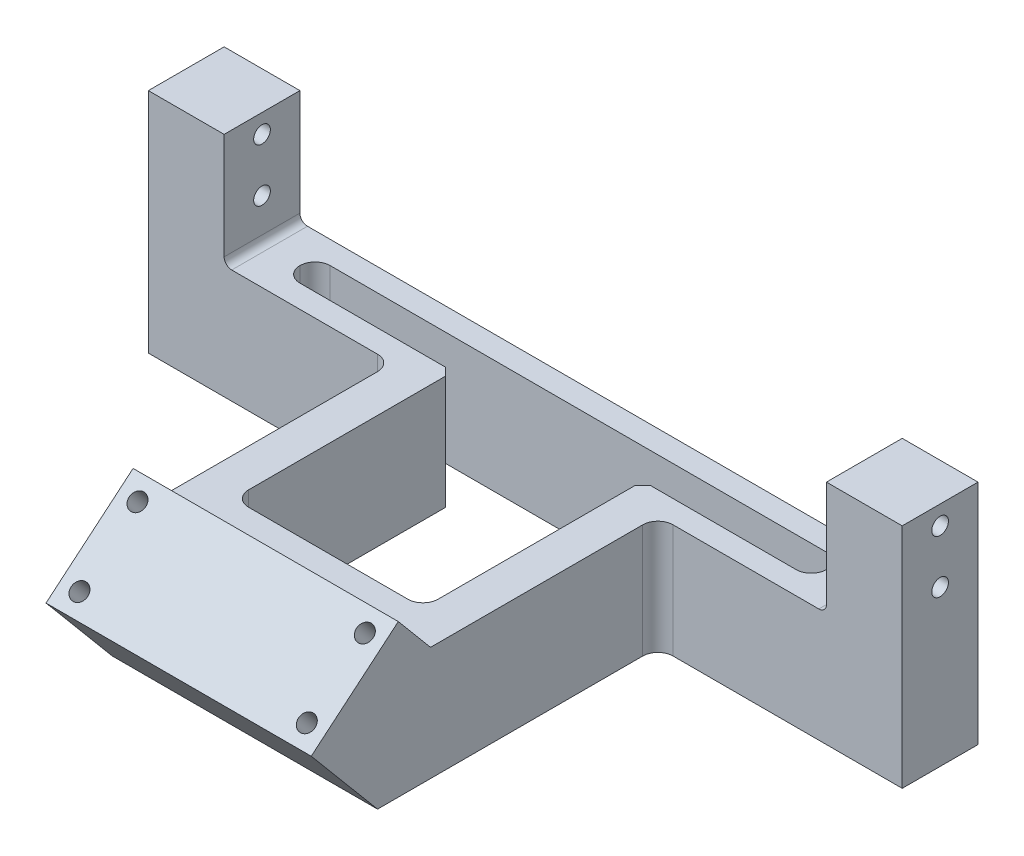
from build123d import *

# Parameters (mm, degrees)
BOSS_EXTRUDE1_DEPTH = 12.7
SKETCH2_R           = 1.397
CUT_EXTRUDE1_DEPTH  = 133.569206561
FILLET1_R           = 1.27
BOSS_EXTRUDE2_DEPTH = 22.225
CUT_EXTRUDE3_DEPTH  = 97.775414884
FILLET3_R           = 2.54
CHAMFER1_SIZE       = 1.27
SKETCH7_R           = 1.397
CUT_EXTRUDE4_DEPTH  = 6.35


with BuildPart() as part:
    # Sketch1 → Boss-Extrude1 (new body)
    with BuildSketch(Plane.XY):
        Polygon((63.1698, 0), (-63.1698, 0), (-63.1698, 38.1), (-50.4698, 38.1), (-50.4698, 19.05), (50.4698, 19.05), (50.4698, 38.1), (63.1698, 38.1), align=None)
    extrude(amount=BOSS_EXTRUDE1_DEPTH)

    # Sketch2 → Cut-Extrude1 (cut, through all)
    with BuildSketch(Plane.ZY.offset(63.1698)):
        with Locations((6.35, 34.925)):
            Circle(SKETCH2_R)
        with Locations((6.35, 26.035)):
            Circle(SKETCH2_R)
    extrude(amount=-CUT_EXTRUDE1_DEPTH, mode=Mode.SUBTRACT)

    # Fillet1
    fillet1_edges = [part.edges().sort_by_distance(p)[0] for p in [
        (-50.4698, 19.05, 6.35),
        (50.4698, 19.05, 6.35),
    ]]
    fillet(fillet1_edges, radius=FILLET1_R)

    # Sketch3 → Boss-Extrude2 (add, symmetric)
    with BuildSketch(Plane(origin=(0, 0, 0), x_dir=(0, 0, -1), z_dir=(1, 0, 0))):
        Polygon((-12.7, 19.05), (-12.7, 0), (-59.683160888, 0), (-70.796573321, 13.244449193), (-56.203426679, 25.489553157), (-50.8, 19.05), align=None)
    extrude(amount=BOSS_EXTRUDE2_DEPTH, both=True)

    # Sketch6 → Cut-Extrude3 (cut, through all)
    with BuildSketch(Plane(origin=(0, 19.05, 0), x_dir=(1, 0, 0), z_dir=(0, 1, 0))):
        Polygon((44.1198, -3.81), (-44.1198, -3.81), (-44.1198, -8.89), (-15.875, -8.89), (-15.875, -45.72), (15.875, -45.72), (15.875, -8.89), (44.1198, -8.89), align=None)
    extrude(amount=-CUT_EXTRUDE3_DEPTH, mode=Mode.SUBTRACT)

    # Fillet3
    fillet3_edges = [part.edges().sort_by_distance(p)[0] for p in [
        (44.1198, 9.525, 8.89),
        (44.1198, 9.525, 3.81),
        (15.875, 9.525, 45.72),
        (-15.875, 9.525, 45.72),
        (-44.1198, 9.525, 8.89),
        (-44.1198, 9.525, 3.81),
        (22.225, 9.525, 12.7),
        (-22.225, 9.525, 12.7),
    ]]
    fillet(fillet3_edges, radius=FILLET3_R - 0.0001)  # a hair under: the kernel refuses the full size

    # Chamfer1
    chamfer1_edges = [part.edges().sort_by_distance(p)[0] for p in [
        (15.875, 9.525, 8.89),
        (-15.875, 9.525, 8.89),
    ]]
    chamfer(chamfer1_edges, length=CHAMFER1_SIZE)

    # Sketch7 → Cut-Extrude4 (cut, symmetric)
    with BuildSketch(Plane(origin=(0, 42.632668976, 35.773056814), x_dir=(1, 0, 0), z_dir=(0, 0.7660444431189747, 0.6427876096865435))):
        with Locations(Location((-19.05, -29.844953746, 0), (0, 0, 270))):
            Circle(SKETCH7_R)
        with Locations(Location((-19.05, -42.544953746, 0), (0, 0, 90))):
            Circle(SKETCH7_R)
        with Locations(Location((19.05, -42.544953746, 0), (0, 0, 270))):
            Circle(SKETCH7_R)
        with Locations(Location((19.05, -29.844953746, 0), (0, 0, 90))):
            Circle(SKETCH7_R)
    extrude(amount=CUT_EXTRUDE4_DEPTH, both=True, mode=Mode.SUBTRACT)


solid = part.part
